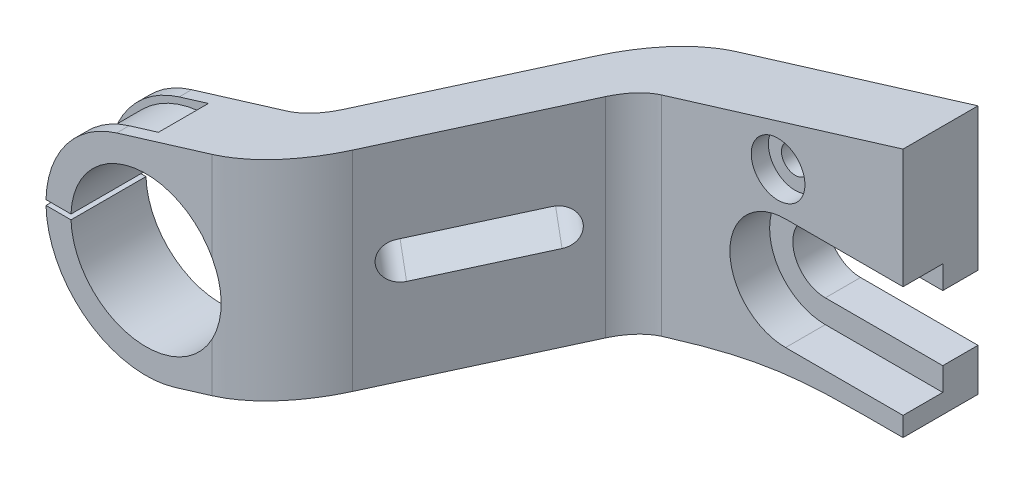
from build123d import *

# Parameters (mm, degrees)
EXTRUDE_THIN1_DEPTH                       = 150
SKETCH2_OUTSIDE_W                         = 349.23
SKETCH2_OUTSIDE_H                         = 219.23
CUT_EXTRUDE1_DEPTH                        = 337.154726279
SKETCH3_R                                 = 30
CUT_EXTRUDE2_DEPTH                        = 323.116973634
CUT_EXTRUDE3_START                        = -15
CUT_EXTRUDE3_DEPTH                        = 10
SKETCH5_W                                 = 100
SKETCH5_H                                 = 2
CUT_EXTRUDE4_DEPTH                        = 323.116973634
CBORE_START                               = 14.1
CBORE_SLOT_FOR_M24_HEX_HEAD_BOLT1_DEPTH   = 15.9
CBORE_SLOT_FOR_M24_HEX_HEAD_BOLT1_2_DEPTH = 14.1
CBORE_FOR_M10_HEX_HEAD_BOLT1_D            = 11
CBORE_FOR_M10_HEX_HEAD_BOLT1_CBORE_D      = 21.48
CBORE_FOR_M10_HEX_HEAD_BOLT1_CBORE_DEPTH  = 6.85
CUT_EXTRUDE5_DEPTH                        = 303.31664336


# Read off the part's stored shape, not the designer's step: CBORE SLOT for M24 Hex Head Bolt1
with BuildPart() as part:
    # Sketch1 → Extrude-Thin1 (new body)
    with BuildSketch(Plane(origin=(0, 0, 0), x_dir=(1, 0, 0), z_dir=(0, 1, 0))):
        with BuildLine():
            Line((0, 0), (-96.684617092, 0))
            ThreePointArc((-96.684617092, 0), (-117.815530179, -4.684610648), (-134.986839248, -17.860619516))
            Line((-134.986839248, -17.860619516), (-181.133234795, -72.855752194))
            ThreePointArc((-181.133234795, -72.855752194), (-188.001758422, -78.126155741), (-196.454123657, -80))
            Line((-196.454123657, -80), (-280, -80))
            Line((-280, -80), (-280, -110))
            Line((-280, -110), (-196.454123657, -110))
            ThreePointArc((-196.454123657, -110), (-175.32321057, -105.315389352), (-158.151901501, -92.139380484))
            Line((-158.151901501, -92.139380484), (-112.005505955, -37.144247806))
            ThreePointArc((-112.005505955, -37.144247806), (-105.136982327, -31.873844259), (-96.684617092, -30))
            Line((-96.684617092, -30), (0, -30))
            Line((0, -30), (0, 0))
        make_face()
    extrude(amount=-EXTRUDE_THIN1_DEPTH)

    # Sketch2 outside → Cut-Extrude1 (cut, through all)
    with BuildSketch(Plane.XY):
        with Locations((-140, -75)):
            Rectangle(SKETCH2_OUTSIDE_W, SKETCH2_OUTSIDE_H)
        with BuildLine():
            Line((0, 0), (-234.676511429, -71.747809761))
            ThreePointArc((-234.676511429, -71.747809761), (-261.233833478, -121.694868189), (-211.286775051, -148.252190239))
            Line((-211.286775051, -148.252190239), (-95, -112.699755258))
            add(Edge.make_bspline(
                [(-95, -112.699755258), (-51.532544729, -99.410420536), (-36.95554526, -100), (0, -100)],
                knots=[0, 0, 0, 0, 1, 1, 1, 1], degree=3))
            Line((0, -100), (0, 0))
        make_face(mode=Mode.SUBTRACT)
    extrude(amount=CUT_EXTRUDE1_DEPTH, mode=Mode.SUBTRACT)

    # Sketch3 → Cut-Extrude2 (cut, through all)
    with BuildSketch(Plane.XY.offset(110)):
        with Locations(Location((-222.98164324, -110, 0), (0, 0, 27.840553026))):
            Circle(SKETCH3_R)
    extrude(amount=-CUT_EXTRUDE2_DEPTH, mode=Mode.SUBTRACT)

    # Sketch4 → Cut-Extrude3 (cut, symmetric)
    with BuildSketch(Plane.XY.offset(110).offset(CUT_EXTRUDE3_START)):
        with BuildLine():
            Line((-222.98164324, -68.172329741), (-222.98164324, -72.5))
            ThreePointArc((-222.98164324, -72.5), (-260.48164324, -110), (-222.98164324, -147.5))
            Line((-222.98164324, -147.5), (-222.98164324, -150))
            ThreePointArc((-222.98164324, -150), (-262.542277774, -115.912376445), (-234.676511429, -71.747809761))
            Line((-234.676511429, -71.747809761), (-222.98164324, -68.172329741))
        make_face()
    extrude(amount=CUT_EXTRUDE3_DEPTH, both=True, mode=Mode.SUBTRACT)

    # Sketch5 → Cut-Extrude4 (cut, through all)
    with BuildSketch(Plane.XY.offset(110)):
        with Locations((-272.98164324, -110)):
            Rectangle(SKETCH5_W, SKETCH5_H)
    extrude(amount=-CUT_EXTRUDE4_DEPTH, mode=Mode.SUBTRACT)

    # CBORE SLOT for M24 Hex Head Bolt1 outlin → CBORE SLOT for M24 Hex Head Bolt1 (cut)
    with BuildSketch(Plane.XY.offset(CBORE_START)):
        with BuildLine():
            Line((0, -47.715), (-47, -47.715))
            ThreePointArc((-47, -47.715), (-69.285, -70), (-47, -92.285))
            Line((-47, -92.285), (0, -92.285))
            Line((0, -92.285), (0, -47.715))
        make_face()
    extrude(amount=CBORE_SLOT_FOR_M24_HEX_HEAD_BOLT1_DEPTH, mode=Mode.SUBTRACT)

    # CBORE SLOT for M24 Hex Head Bolt1 2 outl → CBORE SLOT for M24 Hex Head Bolt1 2 (cut)
    with BuildSketch(Plane.XY):
        with BuildLine():
            Line((0, -83), (0, -57))
            Line((0, -57), (-47, -57))
            ThreePointArc((-47, -57), (-60, -70), (-47, -83))
            Line((-47, -83), (0, -83))
        make_face()
    extrude(amount=CBORE_SLOT_FOR_M24_HEX_HEAD_BOLT1_2_DEPTH, mode=Mode.SUBTRACT)

    # CBORE for M10 Hex Head Bolt1 (through all)
    with Locations(Plane.XY.offset(30)):
        with Locations((-50, -32)):
            CounterBoreHole(CBORE_FOR_M10_HEX_HEAD_BOLT1_D / 2, CBORE_FOR_M10_HEX_HEAD_BOLT1_CBORE_D / 2, CBORE_FOR_M10_HEX_HEAD_BOLT1_CBORE_DEPTH)

    # Sketch11 → Cut-Extrude5 (cut, through all)
    with BuildSketch(Plane(origin=(-47.437557366, 0, -39.80483689), x_dir=(0.6427876096865384, 0, -0.7660444431189788), z_dir=(0.7660444431189788, 0, 0.6427876096865384))):
        with BuildLine():
            Line((-159.78881321, -80.089014291), (-115.633379107, -71.411593064))
            ThreePointArc((-115.633379107, -71.411593064), (-106.827903218, -77.32459521), (-112.740905364, -86.130071099))
            Line((-112.740905364, -86.130071099), (-156.896339468, -94.807492326))
            ThreePointArc((-156.896339468, -94.807492326), (-165.701815356, -88.89449018), (-159.78881321, -80.089014291))
        make_face()
    extrude(amount=-CUT_EXTRUDE5_DEPTH, mode=Mode.SUBTRACT)


solid = part.part
